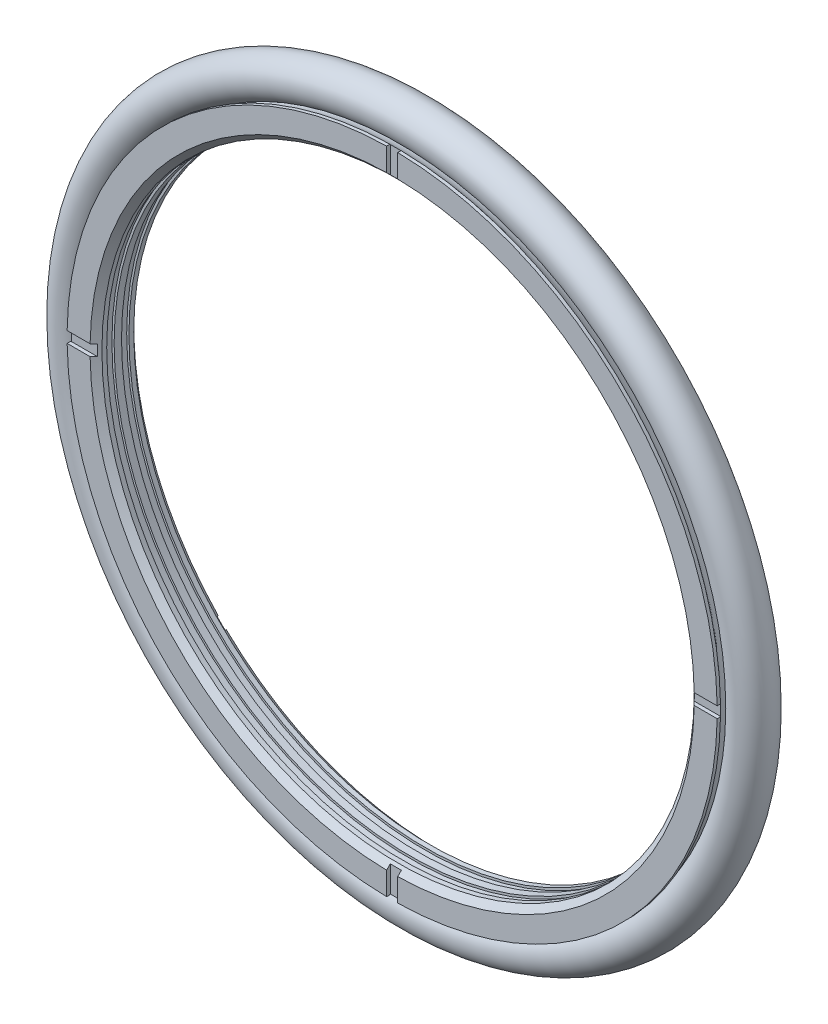
from build123d import *

# Parameters (mm, degrees)
SKETCH4_W          = 1.5
SKETCH4_H          = 16.449772914
CUT_EXTRUDE1_DEPTH = 0.5
CUT_EXTRUDE2_DEPTH = 0.5
CIRPATTERN1_COUNT  = 4
SKETCH2_R          = 2.65


with BuildPart() as part:
    # Sketch1 → Revolve1 (revolve)
    with BuildSketch(Plane(origin=(0, 0, 0), x_dir=(0, 0, -1), z_dir=(1, 0, 0))):
        with BuildLine():
            Line((-2.15, 40), (-1.5, 40))
            Line((-1.5, 40), (-1.5, 40.3))
            Line((-1.5, 40.3), (-0.5, 40.3))
            Line((-0.5, 40.3), (-0.5, 40))
            Line((-0.5, 40), (0.5, 40))
            Line((0.5, 40), (0.5, 40.3))
            Line((0.5, 40.3), (1.5, 40.3))
            Line((1.5, 40.3), (1.5, 40))
            Line((1.5, 40), (2.15, 40))
            Line((2.15, 40), (2.95, 40.8))
            Line((2.95, 40.8), (2.95, 43.9))
            Line((2.95, 43.9), (2.5, 43.9))
            ThreePointArc((2.5, 43.9), (0, 42.603720497), (-2.5, 43.9))
            Line((-2.5, 43.9), (-2.95, 43.9))
            Line((-2.95, 43.9), (-2.95, 40.8))
            Line((-2.95, 40.8), (-2.15, 40))
        make_face()
    revolve(axis=Axis((0, 0, 0), (0, 0, -1)))

    # Sketch4 → Cut-Extrude1 (cut)
    with BuildSketch(Plane.XY.offset(2.95)):
        with Locations((0, 42.20188555)):
            Rectangle(SKETCH4_W, SKETCH4_H)
    cut_extrude1 = extrude(amount=-CUT_EXTRUDE1_DEPTH, mode=Mode.SUBTRACT)

    # Sketch5 → Cut-Extrude2 (cut)
    with BuildSketch(Plane(origin=(0, 0, -2.95), x_dir=(-1, 0, 0), z_dir=(0, 0, -1))):
        Polygon((33.603985041, 32.543324869), (32.543324869, 33.603985041), (24.925514037, 25.986174209), (25.986174209, 24.925514037), align=None)
    cut_extrude2 = extrude(amount=-CUT_EXTRUDE2_DEPTH, mode=Mode.SUBTRACT)

    # CirPattern1: Cut-Extrude1, Cut-Extrude2 ×4 about axis
    cirpattern1_axis = Axis((0, 0, 0), (0, 0, 1))
    add([cut_extrude1.rotate(cirpattern1_axis, i * 360 / CIRPATTERN1_COUNT) for i in range(1, CIRPATTERN1_COUNT)], mode=Mode.SUBTRACT)
    add([cut_extrude2.rotate(cirpattern1_axis, i * 360 / CIRPATTERN1_COUNT) for i in range(1, CIRPATTERN1_COUNT)], mode=Mode.SUBTRACT)


with BuildPart() as body_2:
    # Sketch2 → Revolve2 (revolve)
    with BuildSketch(Plane(origin=(0, 0, 0), x_dir=(0, 0, -1), z_dir=(1, 0, 0))):
        with Locations((0, 45.85)):
            Circle(SKETCH2_R)
    revolve(axis=Axis((0, 0, 0), (0, 0, -1)))


solid = Compound([part.part, body_2.part])
